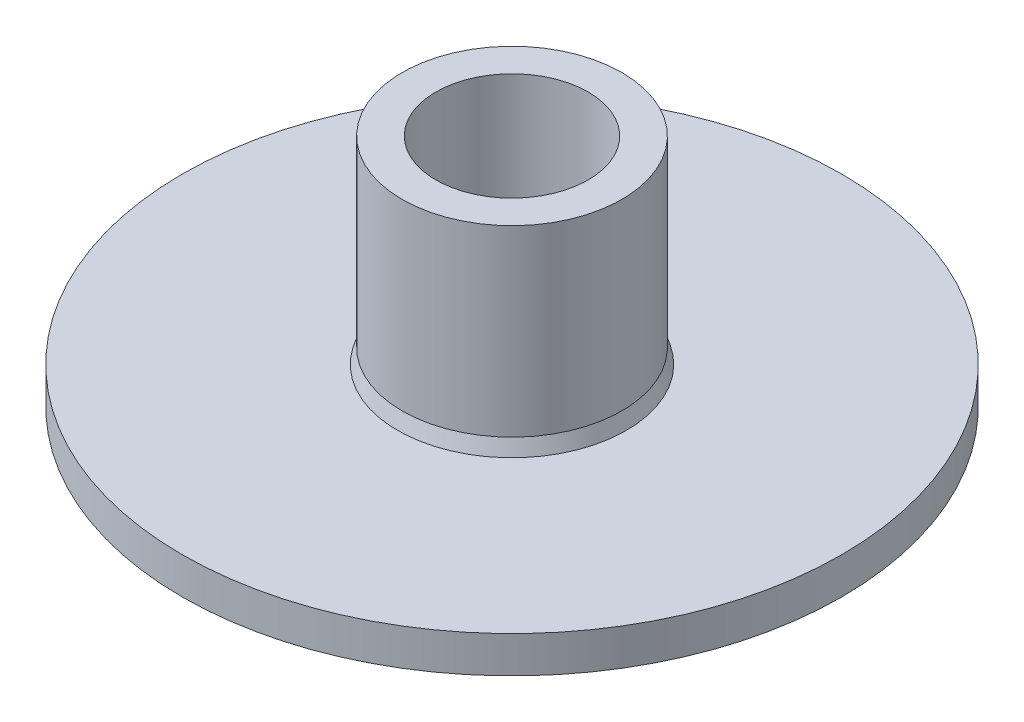
from build123d import *

# Parameters (mm, degrees)
RACCORDO2_R = 0.2


with BuildPart() as part:
    # Schizzo1 → Rivoluzione1 (revolve)
    with BuildSketch(Plane.XY):
        Polygon((-45, 5), (-45, 0), (-34.4, 0), (-34.4, 1.3), (-32, 1.3), (-32, 0), (-29.5, 0), (-29.5, 1.3), (-27.1, 1.3), (-27.1, 0), (-24, 0), (-18.4, 0), (-18.4, 1.3), (-16, 1.3), (-16, 0), (-13, 0), (-10.4, 8.5), (-10.4, 32), (-15, 32), (-15, 7), (-15.611764706, 5), align=None)
    revolve(axis=Axis((0, 0, 0), (0, 1, 0)))

    # Raccordo2
    raccordo2_edges = [part.edges().sort_by_distance(p)[0] for p in [
        (18.4, 1.3, 0),
        (16, 1.3, 0),
        (29.5, 1.3, 0),
        (27.1, 1.3, 0),
        (34.4, 1.3, 0),
        (32, 1.3, 0),
    ]]
    fillet(raccordo2_edges, radius=RACCORDO2_R)


solid = part.part
